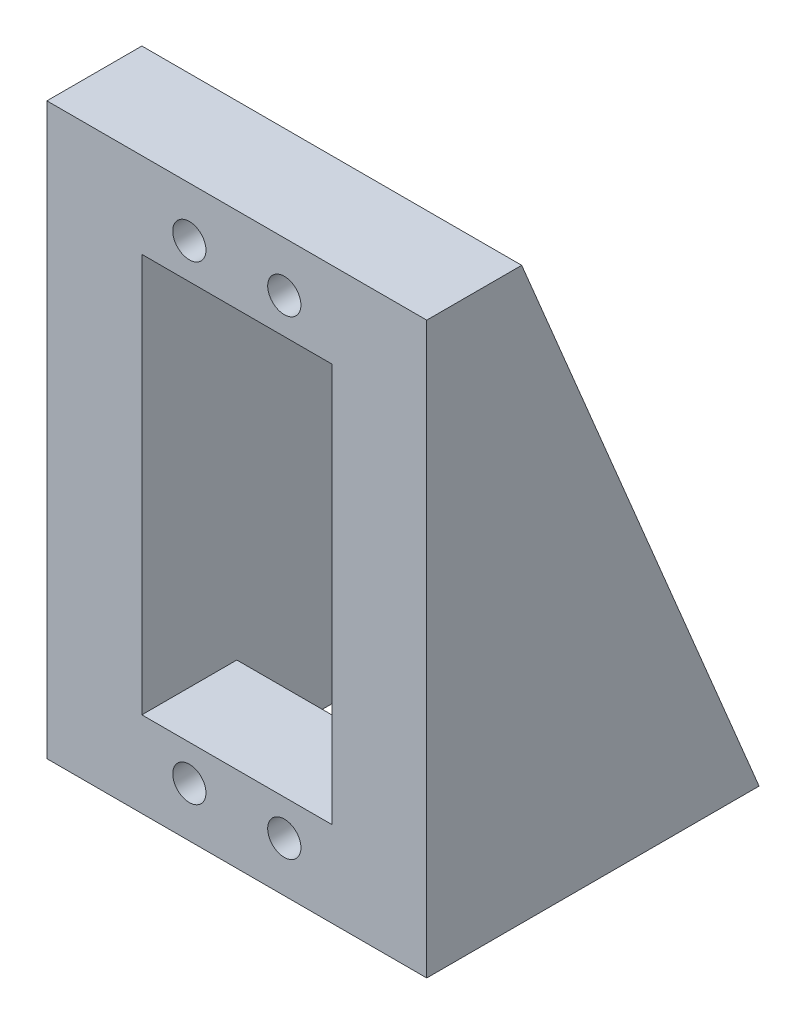
from build123d import *

# Parameters (mm, degrees)
SKETCH2_W           = 40
SKETCH2_H           = 60
SKETCH2_R           = 1.75
BOSS_EXTRUDE1_DEPTH = 10
BOSS_EXTRUDE3_DEPTH = 10
LPATTERN2_COUNT     = 2
LPATTERN2_PITCH     = 30
SKETCH5_R           = 1.25
CUT_EXTRUDE1_DEPTH  = 12


with BuildPart() as part:
    # Sketch2 → Boss-Extrude1 (new body)
    with BuildSketch(Plane.XY):
        Rectangle(SKETCH2_W, SKETCH2_H)
        with Locations((-5, -24.75)):
            Circle(SKETCH2_R, mode=Mode.SUBTRACT)
        with BuildLine():
            ThreePointArc((6.75, -24.75), (5, -26.5), (3.25, -24.75))
            ThreePointArc((3.25, -24.75), (5, -23), (6.75, -24.75))
        make_face(mode=Mode.SUBTRACT)
        Polygon((-11, 21), (0, 21), (11, 21), (11, -21), (0, -21), (-11, -21), align=None, mode=Mode.SUBTRACT)
        with Locations((-5, 24.75)):
            Circle(SKETCH2_R, mode=Mode.SUBTRACT)
        with BuildLine():
            ThreePointArc((6.75, 24.75), (5, 23), (3.25, 24.75))
            ThreePointArc((3.25, 24.75), (5, 26.5), (6.75, 24.75))
        make_face(mode=Mode.SUBTRACT)
    extrude(amount=BOSS_EXTRUDE1_DEPTH)

    # Sketch4 → Boss-Extrude3 (add)
    with BuildSketch(Plane(origin=(20, 0, 0), x_dir=(0, 0, -1), z_dir=(1, 0, 0))):
        Polygon((0, -30), (25, -30), (0, 30), (-10, 30), (-10, -30), align=None)
    boss_extrude3 = extrude(amount=-BOSS_EXTRUDE3_DEPTH)

    # LPattern2: Boss-Extrude3 ×2
    with Locations(*[(-i * LPATTERN2_PITCH, 0, 0) for i in range(1, LPATTERN2_COUNT)]):
        add(boss_extrude3)

    # Sketch5 → Cut-Extrude1 (cut)
    with BuildSketch(Plane.XZ.offset(30)):
        with Locations((-16, -16.7433949)):
            Circle(SKETCH5_R)
        with Locations((-16, 3.2566051)):
            Circle(SKETCH5_R)
        with Locations((-16, -6.7433949)):
            Circle(SKETCH5_R)
        with Locations((16, -16.7433949)):
            Circle(SKETCH5_R)
        with Locations((16, -6.7433949)):
            Circle(SKETCH5_R)
        with Locations((16, 3.2566051)):
            Circle(SKETCH5_R)
    extrude(amount=-CUT_EXTRUDE1_DEPTH, mode=Mode.SUBTRACT)


solid = part.part
